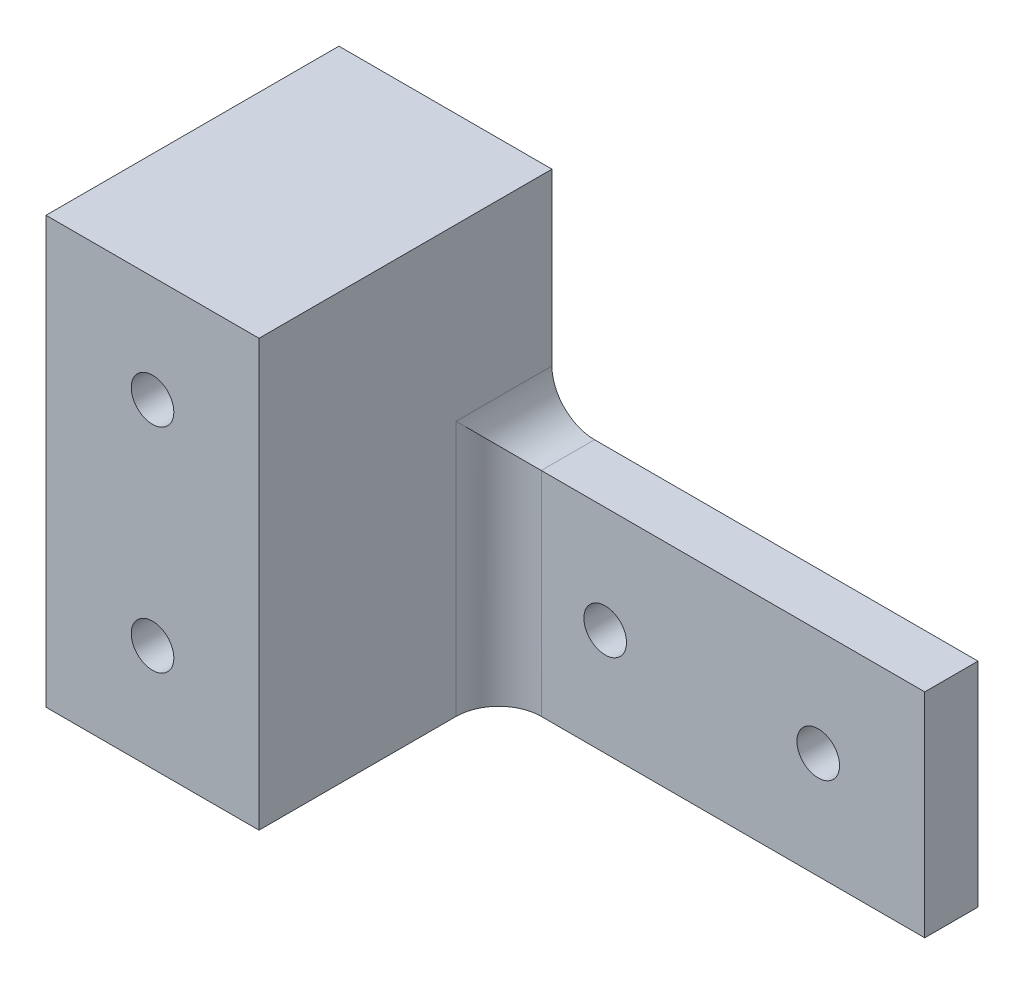
from build123d import *

# Parameters (mm, degrees)
BOSS_EXTRUDE1_DEPTH = 34.925
SKETCH2_R           = 2.54
CUT_EXTRUDE1_DEPTH  = 99.014466407
SKETCH4_W           = 50.8
SKETCH4_H           = 28.575
CUT_EXTRUDE3_DEPTH  = 99.014466407
FILLET1_R           = 5.08
SKETCH5_R           = 4.064
CUT_EXTRUDE4_DEPTH  = 7.62


with BuildPart() as part:
    # Sketch1 → Boss-Extrude1 (new body)
    with BuildSketch(Plane.XY):
        Polygon((0, 0), (0, 50.8), (25.4, 50.8), (25.4, 25.4), (76.2, 25.4), (76.2, 0), align=None)
    extrude(amount=BOSS_EXTRUDE1_DEPTH)

    # Sketch2 → Cut-Extrude1 (cut, through all)
    with BuildSketch(Plane.XY.offset(34.925)):
        with Locations((12.7, 38.1)):
            Circle(SKETCH2_R)
        with Locations((12.7, 12.7)):
            Circle(SKETCH2_R)
        with Locations((38.1, 12.7)):
            Circle(SKETCH2_R)
        with Locations((63.5, 12.7)):
            Circle(SKETCH2_R)
    extrude(amount=-CUT_EXTRUDE1_DEPTH, mode=Mode.SUBTRACT)

    # Sketch4 → Cut-Extrude3 (cut, through all)
    with BuildSketch(Plane.XZ):
        with Locations((50.8, 20.6375)):
            Rectangle(SKETCH4_W, SKETCH4_H)
    extrude(amount=-CUT_EXTRUDE3_DEPTH, mode=Mode.SUBTRACT)

    # Fillet1
    fillet1_edges = [part.edges().sort_by_distance(p)[0] for p in [
        (25.4, 25.4, 3.175),
        (25.4, 12.7, 6.35),
    ]]
    fillet(fillet1_edges, radius=FILLET1_R)

    # Sketch5 → Cut-Extrude4 (cut)
    with BuildSketch(Plane(origin=(0, 0, 0), x_dir=(-1, 0, 0), z_dir=(0, 0, -1))):
        with Locations((-12.7, 38.1)):
            Circle(SKETCH5_R)
    extrude(amount=-CUT_EXTRUDE4_DEPTH, mode=Mode.SUBTRACT)


solid = part.part
